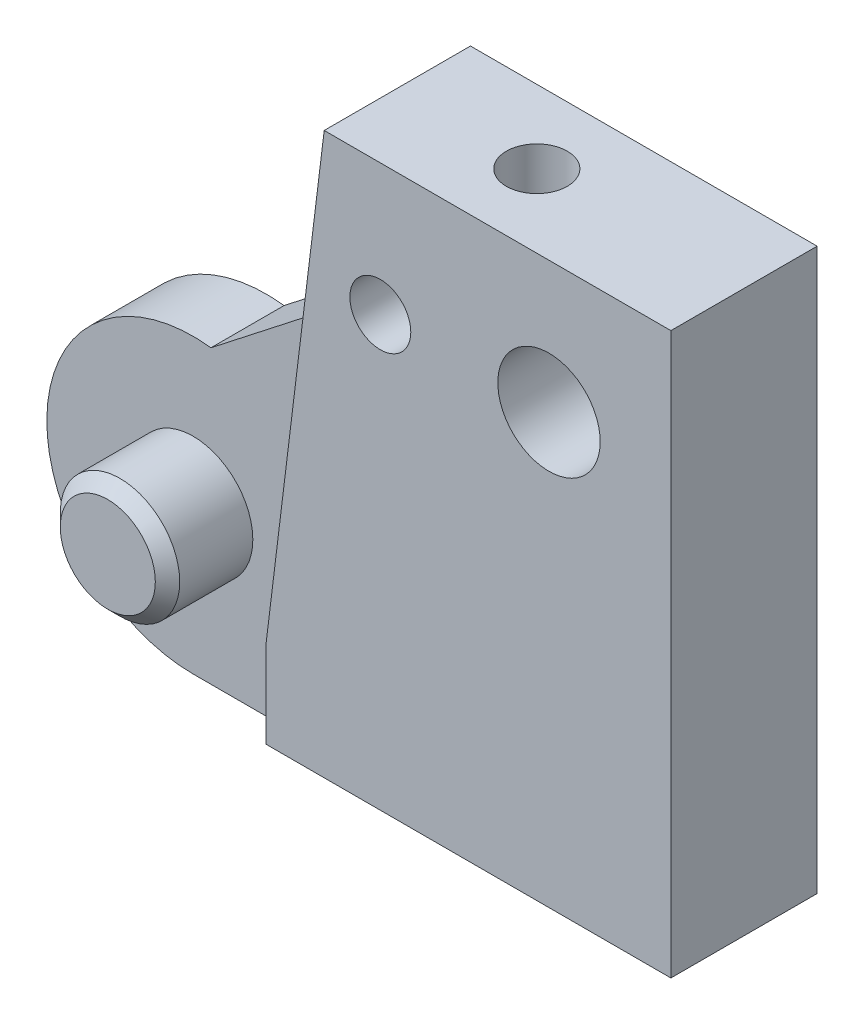
from build123d import *

# Parameters (mm, degrees)
RESSALTO_EXTRUS_O1_DEPTH      = 3
ESBO_O1_3_W                   = 16.6
ESBO_O1_3_H                   = 23
ESBO_O1_3_R                   = 2
ESBO_O1_3_R_2                 = 0.5
RESSALTO_EXTRUS_O2_DEPTH      = 6
CORTE_EXTRUS_O1_DEPTH         = 3
CORTE_EXTRUS_O2_DEPTH         = 29.522973197
CHANFRO1_SIZE                 = 6
FURO_ROSCADO_DE_M3X0_51_D     = 2.5
FURO_ROSCADO_DE_M3X0_51_DEPTH = 8.5
FURO_ROSCADO_DE_M3X0_51_TIP   = 0.751075774
FURO_ROSCADO_DE_M3X0_52_D     = 2.5
FURO_ROSCADO_DE_M3X0_53_D     = 2.5
FURO_ROSCADO_DE_M3X0_53_DEPTH = 3
FURO_ROSCADO_DE_M3X0_53_TIP   = 0.751075774
ESBO_O18_R                    = 2.45
RESSALTO_EXTRUS_O3_DEPTH      = 3.5
CHANFRO2_SIZE                 = 0.5
FURO_ROSCADO_DE_M5X0_81_D     = 4.2
FURO_ROSCADO_DE_M5X0_81_DEPTH = 14
FURO_ROSCADO_DE_M5X0_81_TIP   = 1.2618073


with BuildPart() as part:
    # Esboço1 → Ressalto-extrusão1 (new body)
    with BuildSketch(Plane.XY):
        with BuildLine():
            Line((0, -2), (0, 0))
            Line((0, 0), (0, 16))
            ThreePointArc((0, 16), (-1.757359313, 11.757359313), (-6, 10))
            ThreePointArc((-6, 10), (-12, 4), (-6, -2))
            Line((-6, -2), (0, -2))
        make_face()
    extrude(amount=RESSALTO_EXTRUS_O1_DEPTH)

    # Esboço1<3> → Ressalto-extrusão2 (add)
    with BuildSketch(Plane.XY):
        with Locations((8.3, 11.5)):
            Rectangle(ESBO_O1_3_W, ESBO_O1_3_H)
        with Locations((11.6, 17.6)):
            Circle(ESBO_O1_3_R, mode=Mode.SUBTRACT)
        with Locations((4.68, 17.61)):
            Circle(ESBO_O1_3_R_2, mode=Mode.SUBTRACT)
    extrude(amount=RESSALTO_EXTRUS_O2_DEPTH)

    # Esboço2 → Corte-extrusão1 (cut)
    with BuildSketch(Plane.XY.offset(6)):
        Polygon((0, 3.633024279), (2.37796561, 23), (0, 23), align=None)
    extrude(amount=-CORTE_EXTRUS_O1_DEPTH, mode=Mode.SUBTRACT)

    # Esboço3 → Corte-extrusão2 (cut, through all)
    with BuildSketch(Plane.XY.offset(3)):
        with BuildLine():
            ThreePointArc((-6, 10), (-5.633708763, 9.988808791), (-5.26878394, 9.95527691))
            Line((-5.26878394, 9.95527691), (0.68649297, 9.224060849))
            Line((0.68649297, 9.224060849), (2.37796561, 23))
            Line((2.37796561, 23), (0, 23))
            Line((0, 23), (0, 16))
            ThreePointArc((0, 16), (-1.757359313, 11.757359313), (-6, 10))
        make_face()
    extrude(amount=-CORTE_EXTRUS_O2_DEPTH, mode=Mode.SUBTRACT)

    # Chanfro1
    # the kernel refuses this chamfer: 6 mm, written as the material it adds along each edge
    with BuildSketch(Plane(origin=(0.68649297, 9.224060849, 3), x_dir=(-0.9955217911555101, 0.09453234015153283, 0), z_dir=(0, 0, -1))) as chanfro1_piece_1:
        Polygon((CHANFRO1_SIZE * 0.999621916911, CHANFRO1_SIZE * 0.0274958766106), (-CHANFRO1_SIZE * 0.0274958766106, CHANFRO1_SIZE * 0.999621916911), (0, 0), align=None)
    extrude(amount=3)

    # Furo roscado de M3x0.51
    with Locations(Plane.XZ):
        with Locations((4, 3), (12.6, 3)):
            Hole(FURO_ROSCADO_DE_M3X0_51_D / 2, depth=FURO_ROSCADO_DE_M3X0_51_DEPTH)
            with Locations((0, 0, -(FURO_ROSCADO_DE_M3X0_51_DEPTH + FURO_ROSCADO_DE_M3X0_51_TIP / 2))):  # 118° drill point
                Cone(0, FURO_ROSCADO_DE_M3X0_51_D / 2, FURO_ROSCADO_DE_M3X0_51_TIP, mode=Mode.SUBTRACT)

    # Furo roscado de M3x0.52 (through all)
    with Locations(Plane.XY.offset(6)):
        with Locations((4.68, 17.61)):
            Hole(FURO_ROSCADO_DE_M3X0_52_D / 2)

    # Furo roscado de M3x0.53
    with Locations(Plane(origin=(0, 23, 0), x_dir=(1, 0, 0), z_dir=(0, 1, 0))):
        with Locations((8.1, -3)):
            Hole(FURO_ROSCADO_DE_M3X0_53_D / 2, depth=FURO_ROSCADO_DE_M3X0_53_DEPTH)
            with Locations((0, 0, -(FURO_ROSCADO_DE_M3X0_53_DEPTH + FURO_ROSCADO_DE_M3X0_53_TIP / 2))):  # 118° drill point
                Cone(0, FURO_ROSCADO_DE_M3X0_53_D / 2, FURO_ROSCADO_DE_M3X0_53_TIP, mode=Mode.SUBTRACT)

    # Esboço18 → Ressalto-extrusão3 (add)
    with BuildSketch(Plane.XY.offset(3)):
        with Locations((-6, 4)):
            Circle(ESBO_O18_R)
    extrude(amount=RESSALTO_EXTRUS_O3_DEPTH)

    # Chanfro2
    chanfro2_edges = [part.edges().sort_by_distance(p)[0] for p in [
        (-8.45, 4, 6.5),
    ]]
    chamfer(chanfro2_edges, length=CHANFRO2_SIZE)

    # Furo roscado de M5x0.81
    with Locations(Plane.XY.offset(6)):
        with Locations((11.6, 17.6)):
            Hole(FURO_ROSCADO_DE_M5X0_81_D / 2, depth=FURO_ROSCADO_DE_M5X0_81_DEPTH)
            with Locations((0, 0, -(FURO_ROSCADO_DE_M5X0_81_DEPTH + FURO_ROSCADO_DE_M5X0_81_TIP / 2))):  # 118° drill point
                Cone(0, FURO_ROSCADO_DE_M5X0_81_D / 2, FURO_ROSCADO_DE_M5X0_81_TIP, mode=Mode.SUBTRACT)


solid = part.part
